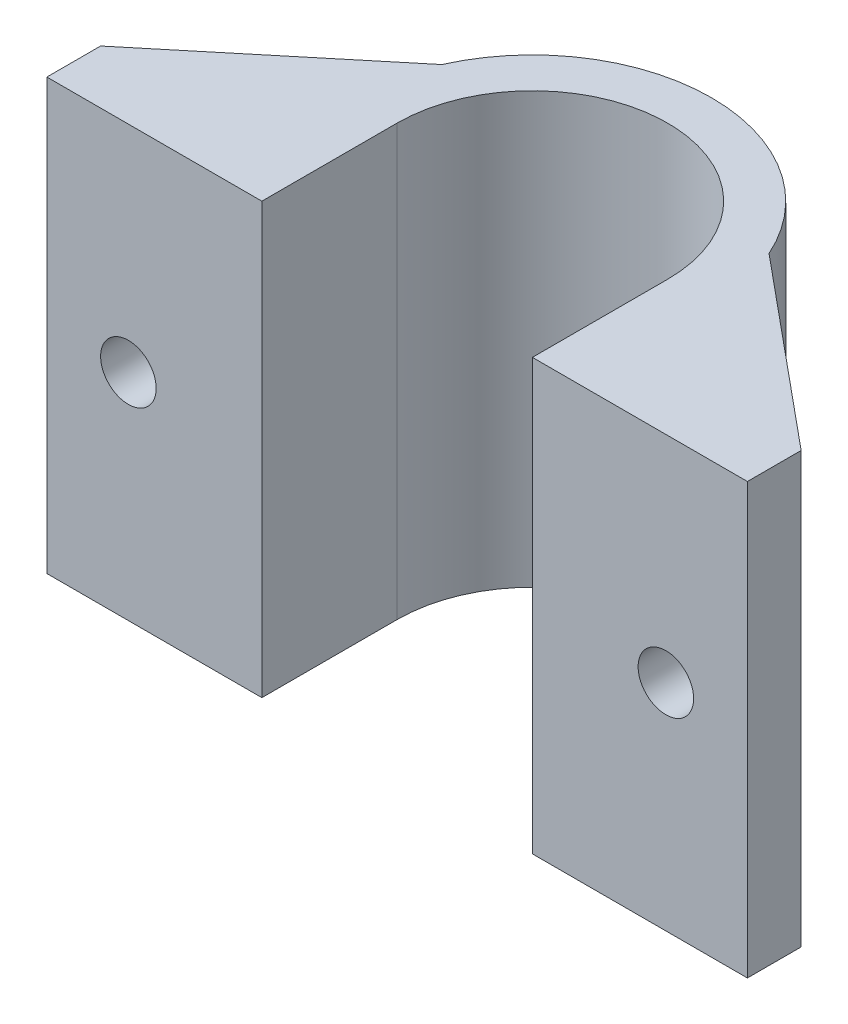
from build123d import *

# Parameters (mm, degrees)
SALIENTE_EXTRUIR1_DEPTH = 24
CROQUIS3_R              = 1.55
CORTAR_EXTRUIR1_DEPTH   = 36.583774392
CORTAR_EXTRUIR2_DEPTH   = 17
CORTAR_EXTRUIR3_DEPTH   = 17


with BuildPart() as part:
    # Croquis2 → Saliente-Extruir1 (new body)
    with BuildSketch(Plane(origin=(0, 0, 0), x_dir=(1, 0, 0), z_dir=(0, 1, 0))):
        with BuildLine():
            Line((-7.55, 0), (-7.55, -7.55))
            Line((-7.55, -7.55), (-19.55, -7.55))
            Line((-19.55, -7.55), (-19.55, -4.55))
            Line((-19.55, -4.55), (-9.131754542, 4.075666691))
            ThreePointArc((-9.131754542, 4.075666691), (-2e-09, 10), (9.131754541, 4.075666695))
            Line((9.131754541, 4.075666695), (19.55, -4.55))
            Line((19.55, -4.55), (19.55, -7.55))
            Line((19.55, -7.55), (7.55, -7.55))
            Line((7.55, -7.55), (7.55, 0))
            ThreePointArc((7.55, 0), (0, 7.55), (-7.55, 0))
        make_face()
    extrude(amount=SALIENTE_EXTRUIR1_DEPTH)

    # Croquis3 → Cortar-Extruir1 (cut, through all)
    with BuildSketch(Plane.XY.offset(7.55)):
        with Locations((15, 12)):
            Circle(CROQUIS3_R)
        with Locations((-15, 12)):
            Circle(CROQUIS3_R)
    extrude(amount=-CORTAR_EXTRUIR1_DEPTH, mode=Mode.SUBTRACT)

    # Croquis4 → Cortar-Extruir2 (cut)
    with BuildSketch(Plane(origin=(0, 21, 0), x_dir=(1, 0, 0), z_dir=(0, 1, 0))):
        Polygon((-9.131754542, 4.075666691), (-19.55, -4.55), (-9.131754542, -4.55), align=None)
    extrude(amount=-CORTAR_EXTRUIR2_DEPTH, mode=Mode.SUBTRACT)

    # Croquis5 → Cortar-Extruir3 (cut)
    with BuildSketch(Plane(origin=(0, 21, 0), x_dir=(1, 0, 0), z_dir=(0, 1, 0))):
        Polygon((19.55, -4.55), (9.131754541, 4.075666695), (9.131754541, -4.55), align=None)
    extrude(amount=-CORTAR_EXTRUIR3_DEPTH, mode=Mode.SUBTRACT)


solid = part.part
